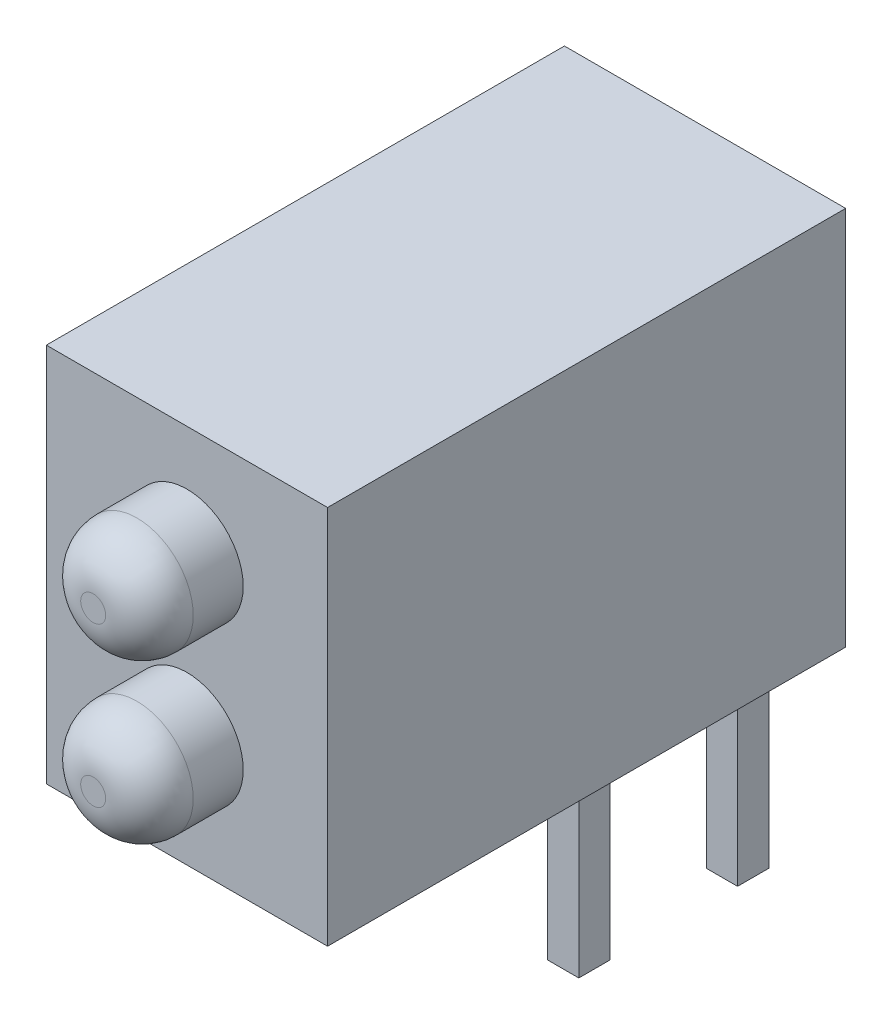
from build123d import *

# Parameters (mm, degrees)
SKETCH1_W           = 4.5
SKETCH1_H           = 6.08
BOSS_EXTRUDE1_DEPTH = 8.29
SKETCH2_R           = 0.9
BOSS_EXTRUDE2_DEPTH = 1.5
FILLET1_R           = 0.7
SKETCH3_W           = 0.5
SKETCH3_H           = 0.5
BOSS_EXTRUDE3_DEPTH = 3.18


with BuildPart() as part:
    # Sketch1 → Boss-Extrude1 (new body)
    with BuildSketch(Plane.XY):
        Rectangle(SKETCH1_W, SKETCH1_H)
    extrude(amount=-BOSS_EXTRUDE1_DEPTH)

    # Sketch2 → Boss-Extrude2 (add)
    with BuildSketch(Plane.XY):
        with Locations((0, 1.27)):
            Circle(SKETCH2_R)
        with Locations((0, -1.27)):
            Circle(SKETCH2_R)
    extrude(amount=BOSS_EXTRUDE2_DEPTH)

    # Fillet1
    fillet1_edges = [part.edges().sort_by_distance(p)[0] for p in [
        (-0.9, -1.27, 1.5),
        (-0.9, 1.27, 1.5),
    ]]
    fillet(fillet1_edges, radius=FILLET1_R)

    # Sketch3 → Boss-Extrude3 (add)
    with BuildSketch(Plane.XZ.offset(3.04)):
        with Locations((-1.27, -7.54)):
            Rectangle(SKETCH3_W, SKETCH3_H)
        with Locations((1.27, -7.54)):
            Rectangle(SKETCH3_W, SKETCH3_H)
        with Locations((-1.27, -5)):
            Rectangle(SKETCH3_W, SKETCH3_H)
        with Locations((1.27, -5)):
            Rectangle(SKETCH3_W, SKETCH3_H)
    extrude(amount=BOSS_EXTRUDE3_DEPTH)


solid = part.part
